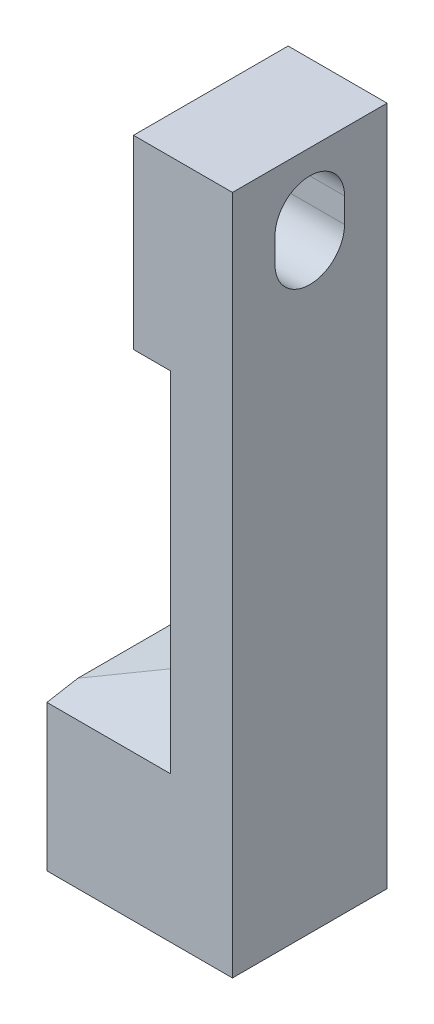
from build123d import *

# Parameters (mm, degrees)
SKETCH1_W           = 15.875
SKETCH1_H           = 69.85
BOSS_EXTRUDE1_DEPTH = 6.35
BOSS_EXTRUDE2_DEPTH = 3.81
BOSS_EXTRUDE3_DEPTH = 12.7
CUT_EXTRUDE1_DEPTH  = 41.411152545
CUT_EXTRUDE2_DEPTH  = 38.228821244


with BuildPart() as part:
    # Sketch1 → Boss-Extrude1 (new body)
    with BuildSketch(Plane(origin=(0, 0, 0), x_dir=(0, 0, -1), z_dir=(1, 0, 0))):
        Rectangle(SKETCH1_W, SKETCH1_H)
    extrude(amount=BOSS_EXTRUDE1_DEPTH)

    # Sketch2 → Boss-Extrude2 (add)
    with BuildSketch(Plane.ZY):
        Polygon((7.9375, 34.925), (-7.9375, 34.925), (-7.9375, 18.674190819), (7.9375, 15.875), align=None)
    extrude(amount=BOSS_EXTRUDE2_DEPTH)

    # Sketch3 → Boss-Extrude3 (add)
    with BuildSketch(Plane.ZY):
        Polygon((-7.9375, -17.145), (-7.9375, -34.925), (7.9375, -34.925), (7.9375, -19.944190819), align=None)
    extrude(amount=BOSS_EXTRUDE3_DEPTH)

    # Sketch6 → Cut-Extrude1 (cut, through all)
    with BuildSketch(Plane(origin=(0, 0, -7.9375), x_dir=(-1, 0, 0), z_dir=(0, 0, -1))):
        Polygon((0, -17.145), (12.7, -17.145), (12.7, -19.384352655), align=None)
    extrude(amount=-CUT_EXTRUDE1_DEPTH, mode=Mode.SUBTRACT)

    # Sketch7 → Cut-Extrude2 (cut, through all)
    with BuildSketch(Plane.ZY.offset(3.81)):
        with BuildLine():
            Line((3.5687, 28.861329786), (3.5687, 26.321329786))
            ThreePointArc((3.5687, 26.321329786), (0, 22.752629786), (-3.5687, 26.321329786))
            Line((-3.5687, 26.321329786), (-3.5687, 28.861329786))
            ThreePointArc((-3.5687, 28.861329786), (0, 32.430029786), (3.5687, 28.861329786))
        make_face()
    extrude(amount=-CUT_EXTRUDE2_DEPTH, mode=Mode.SUBTRACT)


solid = part.part
